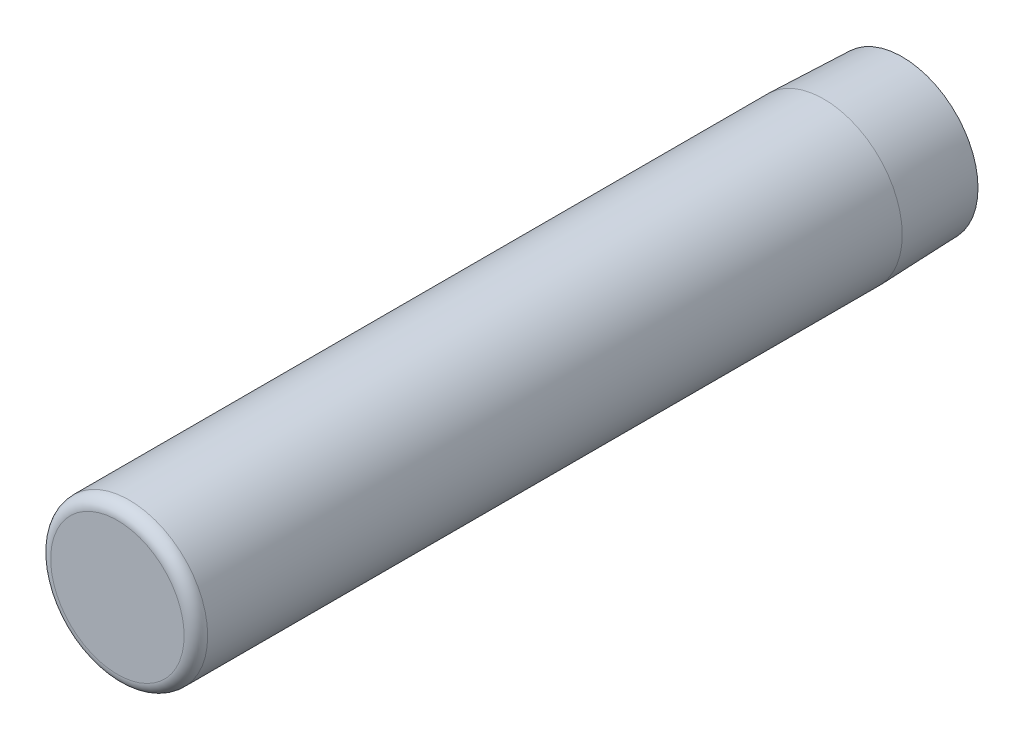
from build123d import *

# Parameters (mm, degrees)
CROQUIS1_R              = 2
SALIENTE_EXTRUIR1_DEPTH = 20
CHAFL_N1_SIZE           = 2
CHAFL_N1_SIZE2          = 0.069841539
REDONDEO1_R             = 0.3


with BuildPart() as part:
    # Croquis1 → Saliente-Extruir1 (new body)
    with BuildSketch(Plane.XY):
        Circle(CROQUIS1_R)
    extrude(amount=SALIENTE_EXTRUIR1_DEPTH)

    # Chaflán1
    chafl_n1_edges = [part.edges().sort_by_distance(p)[0] for p in [
        (-2, 0, 0),
    ]]
    chafl_n1_side = [part.faces().sort_by_distance(p)[0] for p in [
        (-2, 0, 10),
    ]]
    chamfer(chafl_n1_edges, length=CHAFL_N1_SIZE, length2=CHAFL_N1_SIZE2, reference=chafl_n1_side[0])

    # Redondeo1
    redondeo1_edges = [part.edges().sort_by_distance(p)[0] for p in [
        (-2, 0, 20),
    ]]
    fillet(redondeo1_edges, radius=REDONDEO1_R)


solid = part.part
